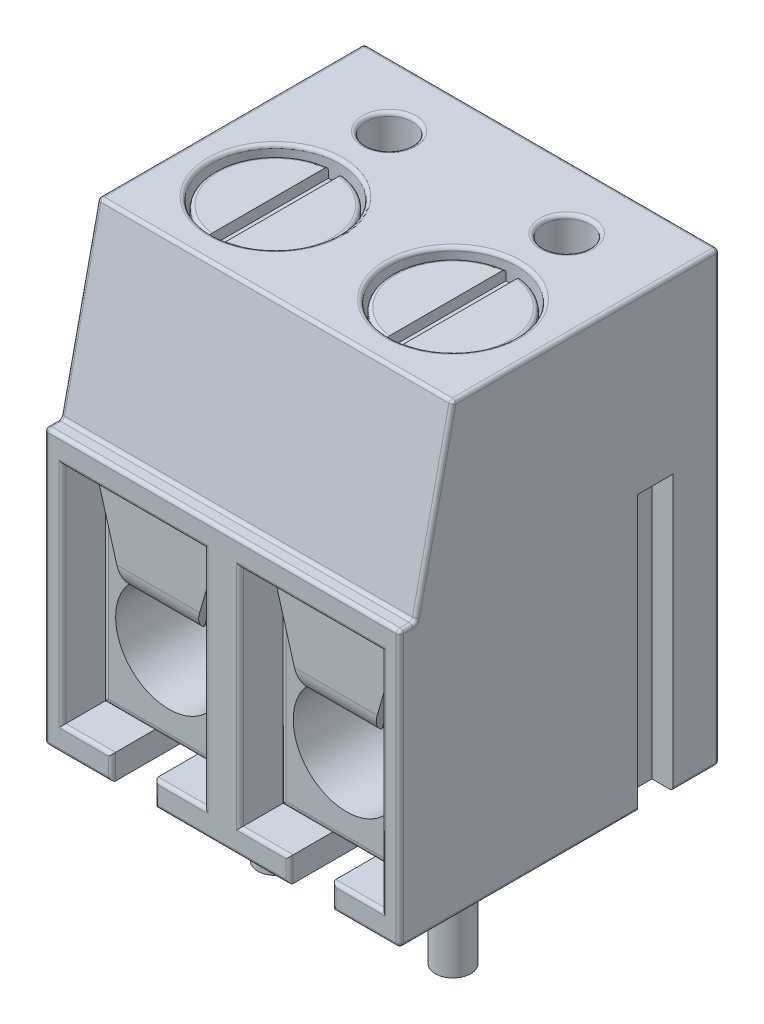
from build123d import *

# Parameters (mm, degrees)
SKETCH_1_W          = 10
SKETCH_1_H          = 12.6
EXTRUDE_1_DEPTH     = 9
CUT_EXTRUDE_1_DEPTH = 15.85563866
SKETCH_4_W          = 4
SKETCH_4_H          = 6.337763822
CUT_EXTRUDE_2_DEPTH = 1
SKETCH_6_W          = 3.8
SKETCH_6_H          = 6.137763822
CUT_EXTRUDE_4_DEPTH = 4.6
SKETCH_7_R          = 0.5
EXTRUDE_3_DEPTH     = 4.4
SKETCH_8_R          = 1.5
CUT_EXTRUDE_5_DEPTH = 3.4
EXTRUDE_4_DEPTH     = 0.3
FILLET_1_R          = 0.7
FILLET_2_R          = 0.2
SKETCH_10_R         = 1.8
SKETCH_10_R_2       = 0.65
CUT_EXTRUDE_6_DEPTH = 1
SKETCH_11_R         = 1.7
EXTRUDE_6_DEPTH     = 0.8
CUT_EXTRUDE_START   = -0.3
CUT_EXTRUDE_7_DEPTH = 0.3
SKETCH_15_W         = 1
SKETCH_15_H         = 7.737763822
EXTRUDE_8_DEPTH     = 0.6
SKETCH_16_W         = 1
SKETCH_16_H         = 7.737763822
CUT_EXTRUDE_8_DEPTH = 0.6
FILLET_3_R          = 0.1
FILLET_4_R          = 0.4


with BuildPart() as part:
    # Эскиз1 → Бобышка-Вытянуть1 (new body)
    with BuildSketch(Plane.XY):
        Rectangle(SKETCH_1_W, SKETCH_1_H)
    extrude(amount=EXTRUDE_1_DEPTH)

    # Эскиз2 → Вырез-Вытянуть1 (cut, through all)
    with BuildSketch(Plane(origin=(5, 0, 0), x_dir=(0, 0, -1), z_dir=(1, 0, 0))):
        with BuildLine():
            Line((-9, 1.437763822), (-8.639962647, 1.437763822))
            ThreePointArc((-8.639962647, 1.437763822), (-8.577228669, 1.459889257), (-8.542255021, 1.516474864))
            Line((-8.542255021, 1.516474864), (-7.5, 6.3))
            Line((-7.5, 6.3), (-9, 6.3))
            Line((-9, 6.3), (-9, 1.437763822))
        make_face()
    extrude(amount=-CUT_EXTRUDE_1_DEPTH, mode=Mode.SUBTRACT)

    # Эскиз4 → Вырез-Вытянуть2 (cut)
    with BuildSketch(Plane.XY.offset(9)):
        with Locations((-2.5, -2.431118089)):
            Rectangle(SKETCH_4_W, SKETCH_4_H)
        with Locations((2.5, -2.431118089)):
            Rectangle(SKETCH_4_W, SKETCH_4_H)
    extrude(amount=-CUT_EXTRUDE_2_DEPTH, mode=Mode.SUBTRACT)

    # Эскиз6 → Вырез-Вытянуть4 (cut)
    # profile 1 of 2: a face of its own
    with BuildSketch(Plane.XY.offset(9)):
        Polygon((-0.5, 0.737763822), (-4.5, 0.737763822), (-4.5, -5.6), (-3.1, -5.6), (-3.1, -6.3), (-1.9, -6.3), (-1.9, -5.6), (-0.5, -5.6), align=None)
        with Locations((-2.5, -2.431118089)):
            Rectangle(SKETCH_6_W, SKETCH_6_H, mode=Mode.SUBTRACT)
    # profile 2 of 2: a face of its own
    with BuildSketch(Plane.XY.offset(9)):
        Polygon((1.9, -5.6), (0.5, -5.6), (0.5, 0.737763822), (4.5, 0.737763822), (4.5, -5.6), (3.1, -5.6), (3.1, -6.3), (1.9, -6.3), align=None)
        with Locations((2.5, -2.431118089)):
            Rectangle(SKETCH_6_W, SKETCH_6_H, mode=Mode.SUBTRACT)
    extrude(amount=-CUT_EXTRUDE_4_DEPTH, mode=Mode.SUBTRACT)

    # Эскиз7 → Бобышка-Вытянуть3 (add)
    with BuildSketch(Plane.XZ.offset(5.5)):
        with Locations(Location((-2.5, 5, 0), (0, 0, 270))):
            Circle(SKETCH_7_R)
        with Locations(Location((2.5, 5, 0), (0, 0, 270))):
            Circle(SKETCH_7_R)
    extrude(amount=EXTRUDE_3_DEPTH)

    # Эскиз8 → Вырез-Вытянуть5 (cut)
    with BuildSketch(Plane.XY.offset(8)):
        with Locations((-2.5, -3.2)):
            Circle(SKETCH_8_R)
        with Locations((2.5, -3.2)):
            Circle(SKETCH_8_R)
    extrude(amount=-CUT_EXTRUDE_5_DEPTH, mode=Mode.SUBTRACT)

    # Эскиз9 → Бобышка-Вытянуть4 (add)
    with BuildSketch(Plane.XY.offset(8)):
        Polygon((-4.345399001, 0.737763822), (-3.5, -2.189584323), (-1.5, -2.189584323), (-0.654600999, 0.737763822), align=None)
        Polygon((0.654600999, 0.737763822), (1.5, -2.189584323), (3.5, -2.189584323), (4.345399001, 0.737763822), align=None)
    extrude(amount=EXTRUDE_4_DEPTH)

    # Скругление1
    # the kernel refuses this fillet: 0.7 mm, written as the material it takes off along each edge
    with BuildSketch(Plane(origin=(0.063859338, -2.189584323, 8.3), x_dir=(0, 1, 0), z_dir=(1, 0, 0))) as fillet_1_piece_1_section:
        with BuildLine():
            CenterArc((0.574456265, -0.7), FILLET_1_R, 90, 55.150095421)
            Line((0, -0.3), (0, 0))
            Line((0, 0), (0.574456265, 0))
        make_face()
    fillet_1_piece_1 = extrude(amount=4.872281323, mode=Mode.PRIVATE)
    fillet_1_piece_1 = split(fillet_1_piece_1, bisect_by=Plane(origin=(3.611928456, -1.802011641, 8.295571385), z_dir=(-0.9607386247333579, 0.27745503229434504, 0)), keep=Keep.TOP, mode=Mode.PRIVATE)
    fillet_1_piece_1 = split(fillet_1_piece_1, bisect_by=Plane(origin=(1.507741452, -2.216390512, 8.295571385), z_dir=(0.9607386247333575, 0.2774550322943467, 0)), keep=Keep.TOP, mode=Mode.PRIVATE)
    add(fillet_1_piece_1, mode=Mode.SUBTRACT)
    with BuildSketch(Plane(origin=(-4.936140662, -2.189584323, 8.3), x_dir=(0, 1, 0), z_dir=(1, 0, 0))) as fillet_1_piece_2_section:
        with BuildLine():
            CenterArc((0.574456265, -0.7), FILLET_1_R, 90, 55.150095421)
            Line((0, -0.3), (0, 0))
            Line((0, 0), (0.574456265, 0))
        make_face()
    fillet_1_piece_2 = extrude(amount=4.872281323, mode=Mode.PRIVATE)
    fillet_1_piece_2 = split(fillet_1_piece_2, bisect_by=Plane(origin=(-3.492258548, -2.216390512, 8.295571385), z_dir=(0.9607386247333577, 0.2774550322943459, 0)), keep=Keep.TOP, mode=Mode.PRIVATE)
    fillet_1_piece_2 = split(fillet_1_piece_2, bisect_by=Plane(origin=(-1.388071544, -1.802011641, 8.295571385), z_dir=(-0.9607386247333577, 0.277455032294346, 0)), keep=Keep.TOP, mode=Mode.PRIVATE)
    add(fillet_1_piece_2, mode=Mode.SUBTRACT)

    # Скругление2
    # the kernel refuses this fillet: 0.2 mm, written as the material it takes off along each edge
    with BuildSketch(Plane(origin=(-4.4, 0.637763822, 8), x_dir=(0, 0, -1), z_dir=(0, -1, 0)), Plane(origin=(-0.6, -5.5, 8), x_dir=(0, 0, -1), z_dir=(0, 1, 0)), Plane(origin=(0.6, 0.637763822, 8), x_dir=(0, 0, -1), z_dir=(0, -1, 0)), Plane(origin=(4.4, -5.5, 8), x_dir=(0, 0, -1), z_dir=(0, 1, 0))) as fillet_2_piece_1:
        with BuildLine():
            CenterArc((FILLET_2_R, FILLET_2_R), FILLET_2_R, 180, 90)
            Line((0, FILLET_2_R), (0, 0))
            Line((0, 0), (FILLET_2_R, 0))
        make_face()
    extrude(amount=6.137763822, mode=Mode.SUBTRACT)
    with BuildSketch(Plane(origin=(-4.4, -5.5, 8), x_dir=(0, 0, -1), z_dir=(1, 0, 0)), Plane(origin=(0.6, -5.5, 8), x_dir=(0, 0, -1), z_dir=(1, 0, 0))) as fillet_2_piece_2:
        with BuildLine():
            CenterArc((FILLET_2_R, FILLET_2_R), FILLET_2_R, 180, 90)
            Line((0, FILLET_2_R), (0, 0))
            Line((0, 0), (FILLET_2_R, 0))
        make_face()
    extrude(amount=3.8, mode=Mode.SUBTRACT)

    # Эскиз10 → Вырез-Вытянуть6 (cut)
    with BuildSketch(Plane(origin=(0, 6.3, 0), x_dir=(1, 0, 0), z_dir=(0, 1, 0))):
        with Locations(Location((-2.5, -5, 0), (0, 0, 270))):
            Circle(SKETCH_10_R)
        with Locations(Location((-2.5, -1.8, 0), (0, 0, 270))):
            Circle(SKETCH_10_R_2)
        with Locations(Location((2.5, -1.8, 0), (0, 0, 90))):
            Circle(SKETCH_10_R_2)
        with Locations(Location((2.5, -5, 0), (0, 0, 90))):
            Circle(SKETCH_10_R)
    extrude(amount=-CUT_EXTRUDE_6_DEPTH, mode=Mode.SUBTRACT)

    # Эскиз11 → Бобышка-Вытянуть6 (add)
    with BuildSketch(Plane(origin=(0, 5.3, 0), x_dir=(1, 0, 0), z_dir=(0, 1, 0))):
        with Locations(Location((-2.5, -5, 0), (0, 0, 270))):
            Circle(SKETCH_11_R)
        with Locations(Location((2.5, -5, 0), (0, 0, 90))):
            Circle(SKETCH_11_R)
    extrude(amount=EXTRUDE_6_DEPTH)

    # Эскиз12 → Вырез-Вытянуть7 (cut)
    with BuildSketch(Plane(origin=(0, 6.1, 0), x_dir=(1, 0, 0), z_dir=(0, 1, 0)).offset(CUT_EXTRUDE_START)):
        with BuildLine():
            Line((-2.7, -3.311805698), (-2.7, -6.688194302))
            ThreePointArc((-2.7, -6.688194302), (-2.5, -6.7), (-2.3, -6.688194302))
            Line((-2.3, -6.688194302), (-2.3, -3.311805698))
            ThreePointArc((-2.3, -3.311805698), (-2.5, -3.3), (-2.7, -3.311805698))
        make_face()
        with BuildLine():
            Line((2.3, -3.311805698), (2.3, -6.688194302))
            ThreePointArc((2.3, -6.688194302), (2.5, -6.7), (2.7, -6.688194302))
            Line((2.7, -6.688194302), (2.7, -3.311805698))
            ThreePointArc((2.7, -3.311805698), (2.5, -3.3), (2.3, -3.311805698))
        make_face()
    extrude(amount=CUT_EXTRUDE_7_DEPTH, mode=Mode.SUBTRACT)

    # Эскиз15 → Бобышка-Вытянуть8 (add)
    with BuildSketch(Plane.ZY.offset(5)):
        with Locations((1.8, -2.431118089)):
            Rectangle(SKETCH_15_W, SKETCH_15_H)
    extrude(amount=EXTRUDE_8_DEPTH)

    # Эскиз16 → Вырез-Вытянуть8 (cut)
    with BuildSketch(Plane(origin=(5, 0, 0), x_dir=(0, 0, -1), z_dir=(1, 0, 0))):
        with Locations((-1.8, -2.431118089)):
            Rectangle(SKETCH_16_W, SKETCH_16_H)
    extrude(amount=-CUT_EXTRUDE_8_DEPTH, mode=Mode.SUBTRACT)

    # Скругление3
    fillet_3_edges = [part.edges().sort_by_distance(p)[0] for p in [
        (3.8, -5.6, 9),
        (4.05, -6.3, 9),
        (3.1, -5.95, 9),
        (1.9, -5.95, 9),
        (-4.05, -6.3, 9),
        (-5, -2.431118089, 9),
        (-5, 6.3, 3.75),
        (5, 6.3, 3.75),
        (0, 1.437763822, 9),
        (-5, 3.908237432, 8.02112751),
        (0, 6.3, 7.5),
        (-5, 1.459889257, 8.577228669),
        (-5, 1.437763822, 8.819981324),
        (5, 1.437763822, 8.819981324),
        (5, 1.459889257, 8.577228669),
        (5, 3.908237432, 8.02112751),
        (-2.5, 6.3, 3.2),
        (-2.5, 6.3, 1.15),
        (2.5, 6.3, 2.45),
        (2.5, 6.3, 6.8),
        (-0.8, 6.1, 5),
        (4.2, 6.1, 5),
        (-4.2, 6.1, 5),
        (0.8, 6.1, 5),
        (-5, -6.3, 0.65),
        (5, -6.3, 0.65),
        (-0.5, -2.431118089, 9),
        (-2.5, 0.737763822, 9),
        (-4.5, -2.431118089, 9),
        (-3.8, -5.6, 9),
        (5, -2.431118089, 9),
        (0, -6.3, 0),
        (4.5, -2.431118089, 9),
        (2.5, 0.737763822, 9),
        (0.5, -2.431118089, 9),
        (1.2, -5.6, 9),
        (-5, 0, 0),
        (0, 6.3, 0),
        (5, 0, 0),
        (-1.2, -5.6, 9),
        (0, -6.3, 9),
        (-1.9, -5.95, 9),
        (-3.1, -5.95, 9),
        (5, -6.3, 5.65),
        (-5, -6.3, 5.65),
    ]]
    fillet(fillet_3_edges, radius=FILLET_3_R)

    # Скругление4
    fillet_4_edges = [part.edges().sort_by_distance(p)[0] for p in [
        (1.9, -5.95, 4.4),
        (3.1, -5.95, 4.4),
        (-1.9, -5.95, 4.4),
        (-3.1, -5.95, 4.4),
    ]]
    fillet(fillet_4_edges, radius=FILLET_4_R)


solid = part.part
